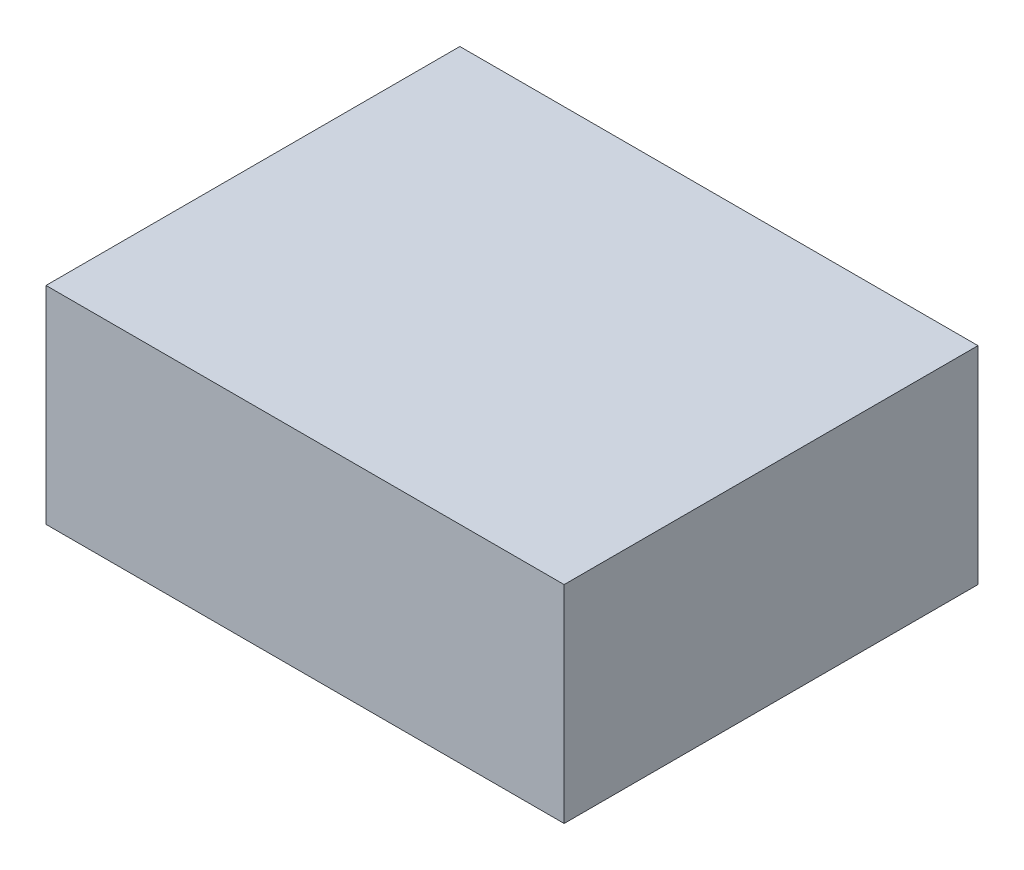
from build123d import *

# Parameters (mm, degrees)
SKETCH1_W           = 31.8
SKETCH1_H           = 25.4
BOSS_EXTRUDE1_DEPTH = 12.7


with BuildPart() as part:
    # Sketch1 → Boss-Extrude1 (new body)
    with BuildSketch(Plane(origin=(0, 0, 0), x_dir=(1, 0, 0), z_dir=(0, 1, 0))):
        Rectangle(SKETCH1_W, SKETCH1_H)
    extrude(amount=BOSS_EXTRUDE1_DEPTH)


solid = part.part
